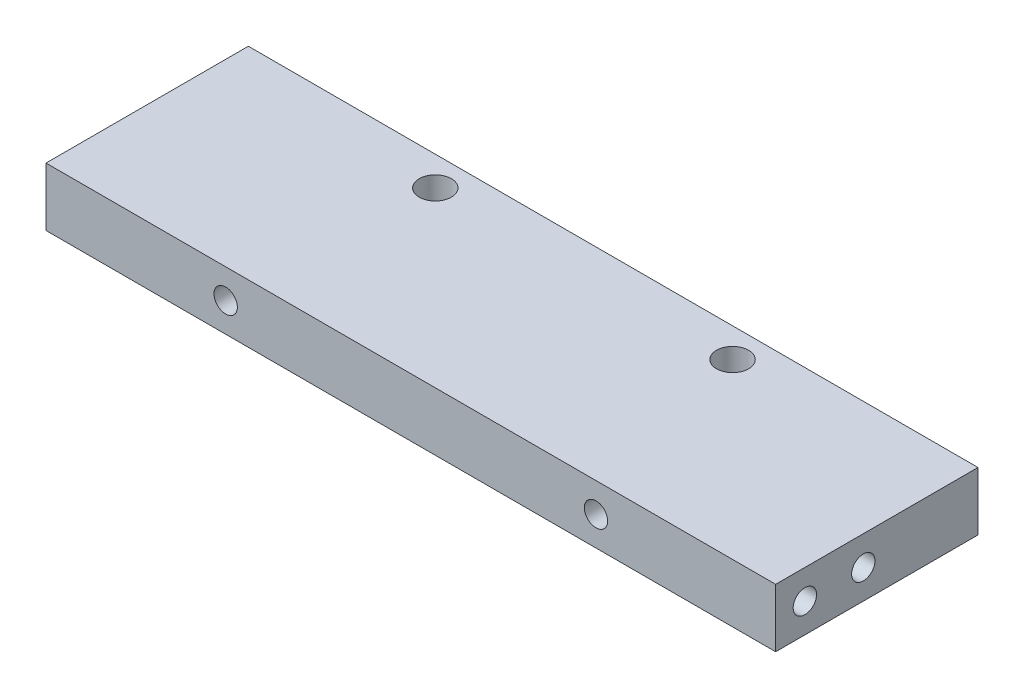
from build123d import *

# Parameters (mm, degrees)
MAIN_STOCK_START                  = 2.248090434
SKETCH_1_W                        = 49.95
SKETCH_1_H                        = 4
MAIN_STOCK_DEPTH                  = 8.851909566
SKETCH_2_R                        = 0.8
FRAME_2XD1P6_THROUGH_DEPTH        = 51.615894766
SKETCH_3_R                        = 0.8
CORNER_L_2XD1P6_BLIND5_DEPTH      = 5
CORNER_R_2XD1P6_BLIND5_START      = -5
SKETCH_4_R                        = 0.8
CORNER_R_2XD1P6_BLIND5_DEPTH      = 5
SKETCH_5_W                        = 49.95
SKETCH_5_H                        = 4
WALL_EXTENSION_TO_FLOOR_DEPTH     = 5
SKETCH_6_R                        = 1.1
HORIZONTAL_BASE_M2_1_0_0043_DEPTH = 4.01


with BuildPart() as part:
    # 草图1 → Main_Stock (new body)
    with BuildSketch(Plane.XY.offset(MAIN_STOCK_START)):
        with Locations((24.675, -2.3)):
            Rectangle(SKETCH_1_W, SKETCH_1_H)
    extrude(amount=MAIN_STOCK_DEPTH)

    # 草图2 → Frame_2xD1p6_Through (cut, through all)
    with BuildSketch(Plane.XY.offset(11.1)):
        with Locations((12, -2.3)):
            Circle(SKETCH_2_R)
        with Locations((37.35, -2.3)):
            Circle(SKETCH_2_R)
    extrude(amount=-FRAME_2XD1P6_THROUGH_DEPTH, mode=Mode.SUBTRACT)

    # 草图3 → Corner_L_2xD1p6_Blind5 (cut)
    with BuildSketch(Plane.ZY.offset(0.3)):
        with Locations((5.1, -2.3)):
            Circle(SKETCH_3_R)
        with Locations((9.1, -2.3)):
            Circle(SKETCH_3_R)
    extrude(amount=-CORNER_L_2XD1P6_BLIND5_DEPTH, mode=Mode.SUBTRACT)

    # 草图4 → Corner_R_2xD1p6_Blind5 (cut)
    with BuildSketch(Plane(origin=(49.65, 0, 0), x_dir=(0, 0, -1), z_dir=(1, 0, 0)).offset(CORNER_R_2XD1P6_BLIND5_START)):
        with Locations((-5.1, -2.3)):
            Circle(SKETCH_4_R)
        with Locations((-9.1, -2.3)):
            Circle(SKETCH_4_R)
    extrude(amount=CORNER_R_2XD1P6_BLIND5_DEPTH, mode=Mode.SUBTRACT)

    # 草图5 → Wall_Extension_To_Floor (add)
    with BuildSketch(Plane(origin=(0, 0, 2.248090434), x_dir=(-1, 0, 0), z_dir=(0, 0, -1))):
        with Locations((-24.675, -2.3)):
            Rectangle(SKETCH_5_W, SKETCH_5_H)
    extrude(amount=WALL_EXTENSION_TO_FLOOR_DEPTH)

    # 草图6 → Horizontal_Base_M2_1_-0.0043 (cut)
    with BuildSketch(Plane.XZ.offset(4.3)):
        with Locations((14.5, -0.75)):
            Circle(SKETCH_6_R)
        with Locations((34.85, -0.75)):
            Circle(SKETCH_6_R)
    extrude(amount=-HORIZONTAL_BASE_M2_1_0_0043_DEPTH, mode=Mode.SUBTRACT)


solid = part.part
